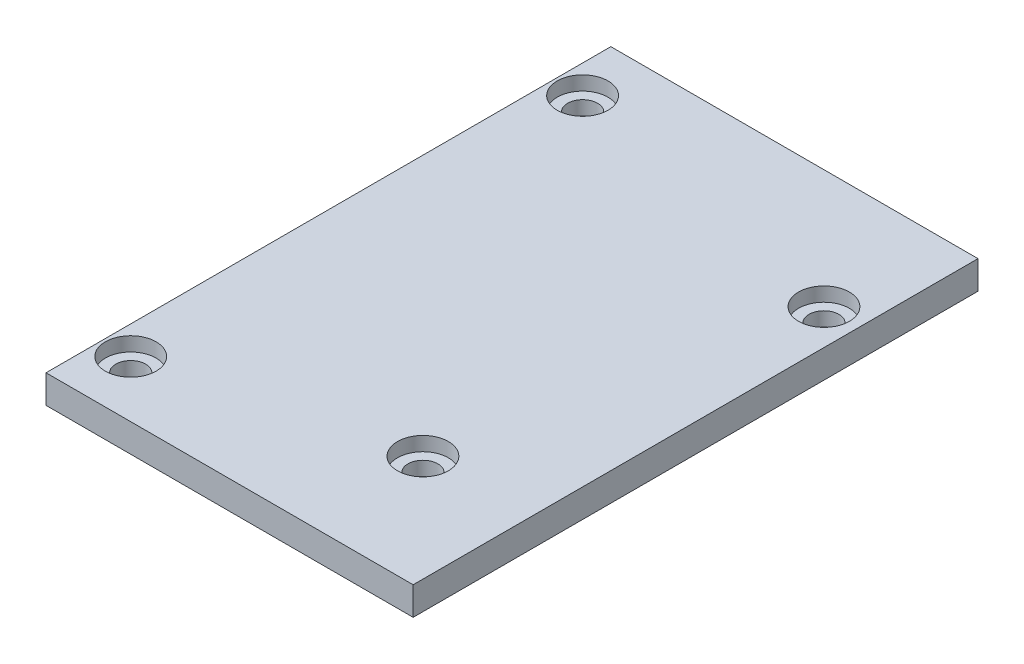
from build123d import *

# Parameters (mm, degrees)
SKETCH2_W           = 65
SKETCH2_H           = 100
SKETCH2_R           = 2.65
BOSS_EXTRUDE1_DEPTH = 5
SKETCH3_R           = 4.5
CUT_EXTRUDE1_DEPTH  = 2.5


with BuildPart() as part:
    # Sketch2 → Boss-Extrude1 (new body)
    with BuildSketch(Plane(origin=(0, 0, 0), x_dir=(1, 0, 0), z_dir=(0, 1, 0))):
        Rectangle(SKETCH2_W, SKETCH2_H)
        with Locations((-27.5, 40)):
            Circle(SKETCH2_R, mode=Mode.SUBTRACT)
        with Locations((-27.5, -40)):
            Circle(SKETCH2_R, mode=Mode.SUBTRACT)
        with Locations((26.23, 29)):
            Circle(SKETCH2_R, mode=Mode.SUBTRACT)
        with Locations((13.65, -29.42)):
            Circle(SKETCH2_R, mode=Mode.SUBTRACT)
    extrude(amount=BOSS_EXTRUDE1_DEPTH)

    # Sketch3 → Cut-Extrude1 (cut)
    with BuildSketch(Plane(origin=(0, 5, 0), x_dir=(1, 0, 0), z_dir=(0, 1, 0))):
        with Locations((26.23, 29)):
            Circle(SKETCH3_R)
        with Locations((13.65, -29.42)):
            Circle(SKETCH3_R)
        with Locations((-27.5, 40)):
            Circle(SKETCH3_R)
        with Locations((-27.5, -40)):
            Circle(SKETCH3_R)
    extrude(amount=-CUT_EXTRUDE1_DEPTH, mode=Mode.SUBTRACT)


solid = part.part
